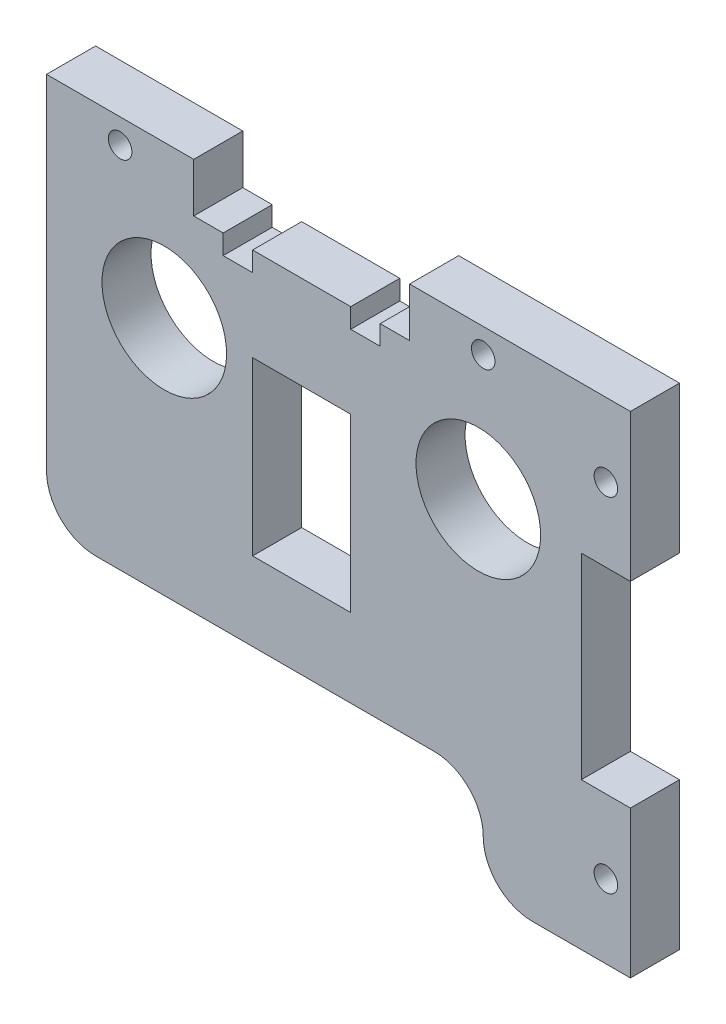
from build123d import *

# Parameters (mm, degrees)
SKETCH1_R           = 6.35
SKETCH1_R_2         = 1.2
SKETCH1_W           = 10
SKETCH1_H           = 17.5
BOSS_EXTRUDE1_DEPTH = 5
SKETCH2_W           = 3
SKETCH2_H           = 2
CUT_EXTRUDE1_DEPTH  = 72.869673716
FILLET1_R           = 5


with BuildPart() as part:
    # Sketch1 → Boss-Extrude1 (new body)
    with BuildSketch(Plane.XY):
        Polygon((0, 40), (15, 40), (15, 35), (26, 35), (37, 35), (37, 40), (59.5, 40), (59.5, 25), (54.5, 25), (54.5, 5), (59.5, 5), (59.5, -10), (44.5, -10), (44.5, 0), (0, 0), align=None)
        with Locations((12, 24.5)):
            Circle(SKETCH1_R, mode=Mode.SUBTRACT)
        with Locations((44, 24.5)):
            Circle(SKETCH1_R, mode=Mode.SUBTRACT)
        with Locations((7.5, 37.5)):
            Circle(SKETCH1_R_2, mode=Mode.SUBTRACT)
        with Locations((44.5, 37.5)):
            Circle(SKETCH1_R_2, mode=Mode.SUBTRACT)
        with Locations((57, 32.5)):
            Circle(SKETCH1_R_2, mode=Mode.SUBTRACT)
        with Locations((57, -2.5)):
            Circle(SKETCH1_R_2, mode=Mode.SUBTRACT)
        with Locations((26, 16.75)):
            Rectangle(SKETCH1_W, SKETCH1_H, mode=Mode.SUBTRACT)
    extrude(amount=BOSS_EXTRUDE1_DEPTH)

    # Sketch2 → Cut-Extrude1 (cut, through all)
    with BuildSketch(Plane.XY.offset(5)):
        with Locations((19.5, 34)):
            Rectangle(SKETCH2_W, SKETCH2_H)
        with Locations((32.5, 34)):
            Rectangle(SKETCH2_W, SKETCH2_H)
    extrude(amount=-CUT_EXTRUDE1_DEPTH, mode=Mode.SUBTRACT)

    # Fillet1
    fillet1_edges = [part.edges().sort_by_distance(p)[0] for p in [
        (44.5, -10, 2.5),
        (44.5, 0, 2.5),
        (0, 0, 2.5),
    ]]
    fillet(fillet1_edges, radius=FILLET1_R - 0.0001)  # a hair under: the kernel refuses the full size


solid = part.part
